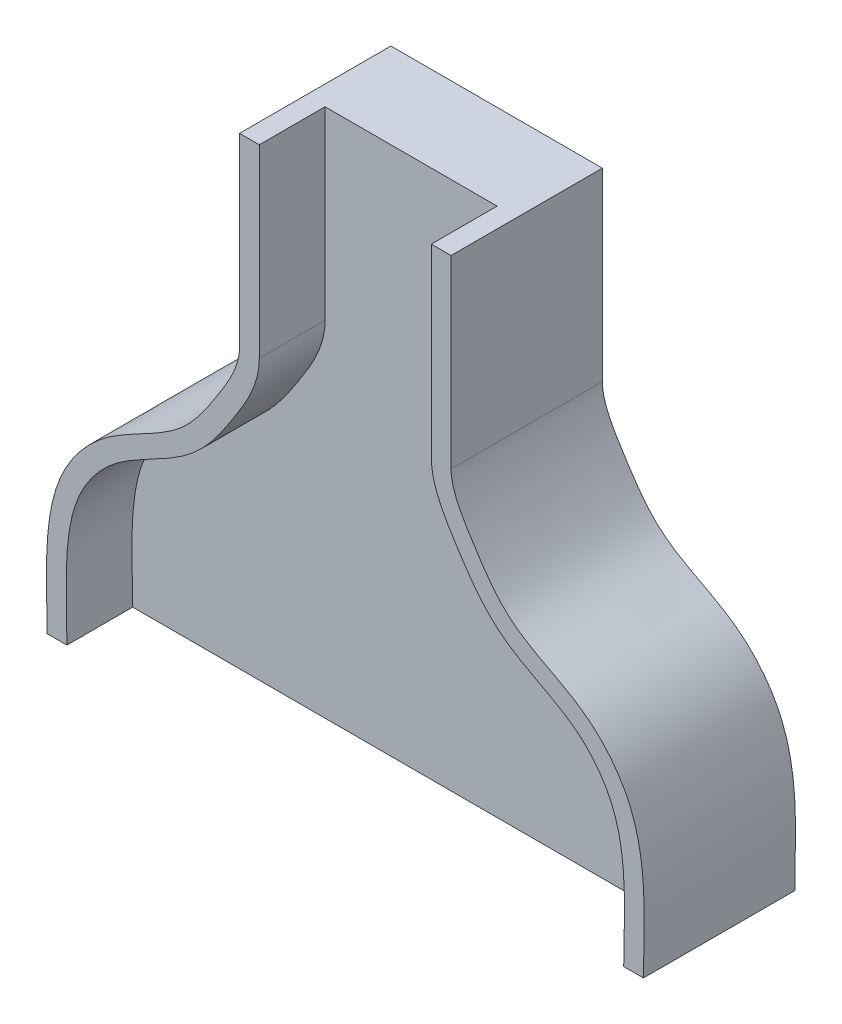
from build123d import *

# Parameters (mm, degrees)
ESTRUSIONE_ESTRUSIONE1_DEPTH = 13
ESTRUSIONE_SOTTILE5_DEPTH    = 10


# Read off the part's stored shape, not the designer's step: Estrusione-Sottile5
with BuildPart() as part:
    # Schizzo1 → Estrusione-Estrusione1 (new body)
    with BuildSketch(Plane.XY):
        with BuildLine():
            Line((32.3920487, 64.599216546), (32.3920487, 92.695802437))
            Line((32.3920487, 92.695802437), (48.470036729, 92.695802437))
            Line((48.470036729, 92.695802437), (48.470036729, 12.199228267))
            Line((48.470036729, 12.199228267), (3.151561413, 12.199228267))
            add(Edge.make_bspline(
                [(3.151561413, 12.199228267), (3.139611177, 19.224996267), (1.892686637, 31.387863298), (12.137321926, 43.966124148), (23.267751598, 47.670295467), (28.997328985, 56.366188951), (32.3920487, 61.880405589), (32.3920487, 64.599216546)],
                knots=[0, 0, 0, 0, 0.347386822, 0.514075999, 0.722780372, 0.866740614, 1, 1, 1, 1], degree=3))
        make_face()
    estrusione_estrusione1 = extrude(amount=ESTRUSIONE_ESTRUSIONE1_DEPTH)

    # Estrusione-Sottile5 outline → Estrusione-Sottile5 (add)
    with BuildSketch(Plane.XY.offset(13)):
        with BuildLine():
            Line((32.3920487, 92.695802437), (32.3920487, 64.599216546))
            add(Edge.make_bspline(
                [(32.3920487, 64.599216546), (32.3920487, 61.880405589), (28.997328985, 56.366188951), (23.267751598, 47.670295467), (12.137321926, 43.966124148), (1.892686637, 31.387863298), (3.139611177, 19.224996267), (3.151561413, 12.199228267)],
                knots=[0, 0, 0, 0, 0.133259386, 0.277219628, 0.485924001, 0.652613178, 1, 1, 1, 1], degree=3))
            Line((3.151561413, 12.199228267), (6.151557074, 12.204331005))
            add(Edge.make_bspline(
                [(6.151557074, 12.204331005), (6.149334866, 13.510808651), (6.119648943, 14.831885644), (6.06293225, 17.480029501), (6.03584378, 18.807019929), (6.037068448, 22.752005394), (6.151453161, 25.333469119), (6.757390346, 28.929919641), (7.030718923, 30.082494468), (7.57350109, 31.725152792), (7.776519692, 32.258469787), (8.231352372, 33.295835374), (8.485381605, 33.804131964), (9.889253187, 36.299307042), (11.433784909, 38.123415419), (13.69240187, 39.947060574), (14.157760625, 40.286091152), (15.150594798, 40.947311626), (15.673944983, 41.267323739), (17.308950011, 42.213099328), (18.485640453, 42.822946504), (20.909634026, 44.126845944), (22.157818902, 44.820909202), (23.995293063, 46.057426343), (24.601789725, 46.502652624), (25.48644282, 47.23845245), (25.775807333, 47.494631032), (26.331807302, 48.016372792), (26.600288227, 48.283277702), (27.899876834, 49.642128534), (28.802450288, 50.804747978), (30.05266046, 52.580806918), (30.452110657, 53.178644998), (31.036934657, 54.076643069), (31.229471218, 54.376192918), (31.61150898, 54.974569074), (31.800421327, 55.271652753), (32.379300522, 56.190094836), (32.774413439, 56.829941685), (33.536773588, 58.171274416), (33.90437134, 58.872854876), (34.558322607, 60.355334084), (34.845244987, 61.13702646), (35.262518462, 62.798404364), (35.3920487, 63.680139971), (35.3920487, 64.599216546)],
                knots=[0, 0, 0, 0, 0.0625, 0.0625, 0.125, 0.125, 0.25, 0.25, 0.3125, 0.3125, 0.34375, 0.34375, 0.375, 0.375, 0.5, 0.5, 0.53125, 0.53125, 0.5625, 0.5625, 0.625, 0.625, 0.6875, 0.6875, 0.71875, 0.71875, 0.734375, 0.734375, 0.75, 0.75, 0.8125, 0.8125, 0.84375, 0.84375, 0.859375, 0.859375, 0.875, 0.875, 0.90625, 0.90625, 0.9375, 0.9375, 0.96875, 0.96875, 1, 1, 1, 1], degree=3))
            Line((35.3920487, 64.599216546), (35.3920487, 92.695802437))
            Line((35.3920487, 92.695802437), (32.3920487, 92.695802437))
        make_face()
    estrusione_sottile5 = extrude(amount=ESTRUSIONE_SOTTILE5_DEPTH)

    # Specchia1: Estrusione-Estrusione1, Estrusione-Sottile5 across plane
    add(estrusione_estrusione1.mirror(Plane(origin=(48.470036729, 12.199228267, 13), x_dir=(0, 0, 1), z_dir=(-1, 0, 0))))
    add(estrusione_sottile5.mirror(Plane(origin=(48.470036729, 12.199228267, 13), x_dir=(0, 0, 1), z_dir=(-1, 0, 0))))


solid = part.part
